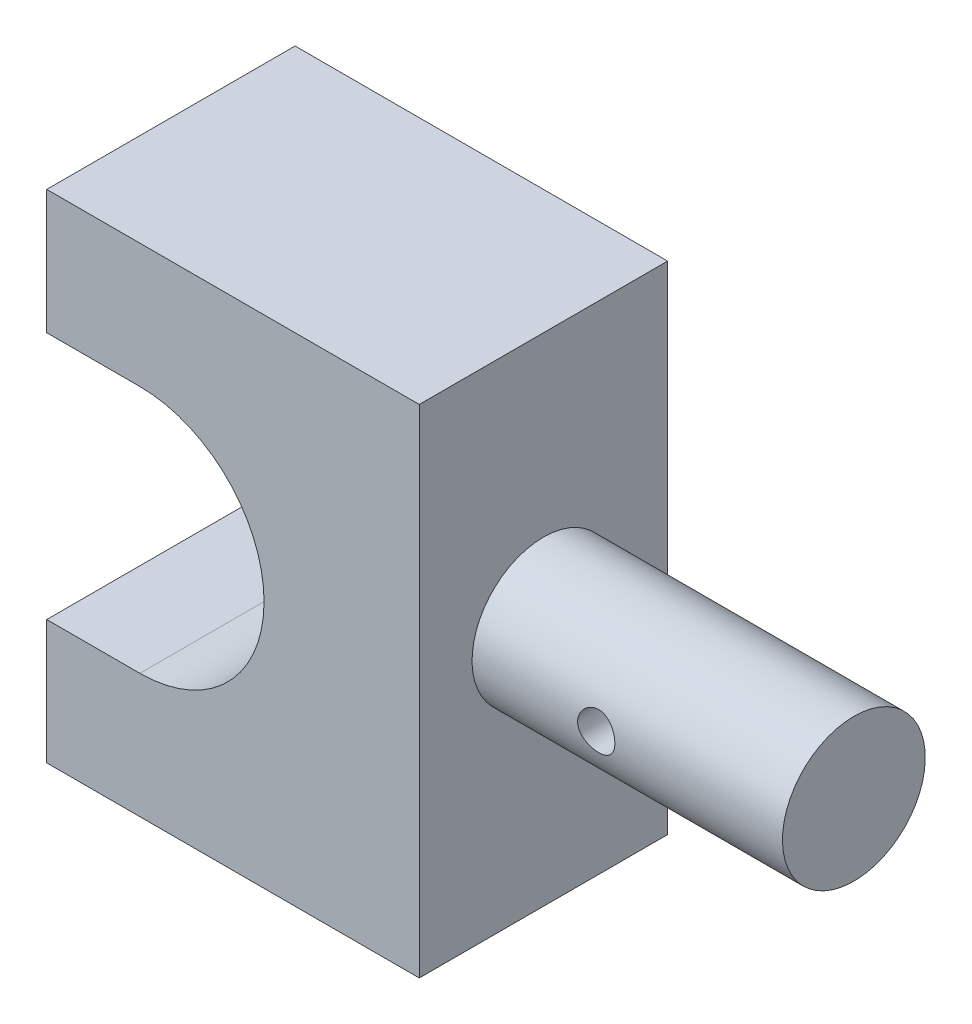
from build123d import *

# Parameters (mm, degrees)
CROQUIS1_W              = 80
CROQUIS1_H              = 80
SALIENTE_EXTRUIR1_DEPTH = 80
CROQUIS3_R              = 11.5
SALIENTE_EXTRUIR2_DEPTH = 50
CORTAR_EXTRUIR1_START   = 28.499999898
CORTAR_EXTRUIR1_DEPTH   = 23.000000204
CORTAR_EXTRUIR2_DEPTH   = 80
CORTAR_EXTRUIR3_START   = 40
CROQUIS7_W              = 20
CROQUIS7_H              = 80
CORTAR_EXTRUIR3_DEPTH   = 60


# Read off the part's stored shape, not the designer's step: Cortar-Extruir1
with BuildPart() as part:
    # Croquis1 → Saliente-Extruir1 (new body)
    with BuildSketch(Plane.XY):
        Rectangle(CROQUIS1_W, CROQUIS1_H)
    extrude(amount=SALIENTE_EXTRUIR1_DEPTH)

    # Croquis3 → Saliente-Extruir2 (add)
    with BuildSketch(Plane(origin=(40, 0, 0), x_dir=(0, 0, -1), z_dir=(1, 0, 0))):
        with Locations(Location((-40, 0, 0), (0, 0, 90))):
            Circle(CROQUIS3_R)
    extrude(amount=SALIENTE_EXTRUIR2_DEPTH)

    # Cortar-Extruir1 outline → Cortar-Extruir1 (cut)
    with BuildSketch(Plane.XY.offset(CORTAR_EXTRUIR1_START)):
        with BuildLine():
            add(Edge.make_bspline(
                [(57, 0), (57, 0.79647294), (57.328173799, 1.571048026), (58.430085354, 2.672492311), (59.211671862, 2.999496362), (60.78449026, 3.00050241), (61.565740512, 2.676816215), (62.676579515, 1.566145107), (62.999665754, 0.786423133), (63.000333703, -0.783870942), (62.675691102, -1.566206232), (61.569794846, -2.673587285), (60.79292663, -2.999619771), (59.20995314, -3.000379538), (58.430916235, -2.672841833), (57.329196069, -1.57255006), (57, -0.79647294), (57, 0)],
                knots=[0, 0, 0, 0, 0.125, 0.125, 0.25, 0.25, 0.375, 0.375, 0.5, 0.5, 0.625, 0.625, 0.75, 0.75, 0.875, 0.875, 1, 1, 1, 1], degree=3))
        make_face()
    extrude(amount=CORTAR_EXTRUIR1_DEPTH, mode=Mode.SUBTRACT)

    # Croquis5 → Cortar-Extruir2 (cut)
    with BuildSketch(Plane.XY.offset(80)):
        with BuildLine():
            Line((-20, 40), (-20, 20))
            Line((-20, 20), (-5, 20))
            ThreePointArc((-5, 20), (15, 0), (-5, -20))
            Line((-5, -20), (-20, -20))
            Line((-20, -20), (-20, -40))
            Line((-20, -40), (-40, -40))
            Line((-40, -40), (-40, 40))
            Line((-40, 40), (-20, 40))
        make_face()
    extrude(amount=-CORTAR_EXTRUIR2_DEPTH, mode=Mode.SUBTRACT)

    # Croquis7 → Cortar-Extruir3 (cut)
    with BuildSketch(Plane(origin=(0, 0, 0), x_dir=(0, 0, -1), z_dir=(1, 0, 0)).offset(CORTAR_EXTRUIR3_START)):
        with Locations((-70, 0)):
            Rectangle(CROQUIS7_W, CROQUIS7_H)
        with Locations((-10, 0)):
            Rectangle(CROQUIS7_W, CROQUIS7_H)
    extrude(amount=-CORTAR_EXTRUIR3_DEPTH, mode=Mode.SUBTRACT)


solid = part.part
